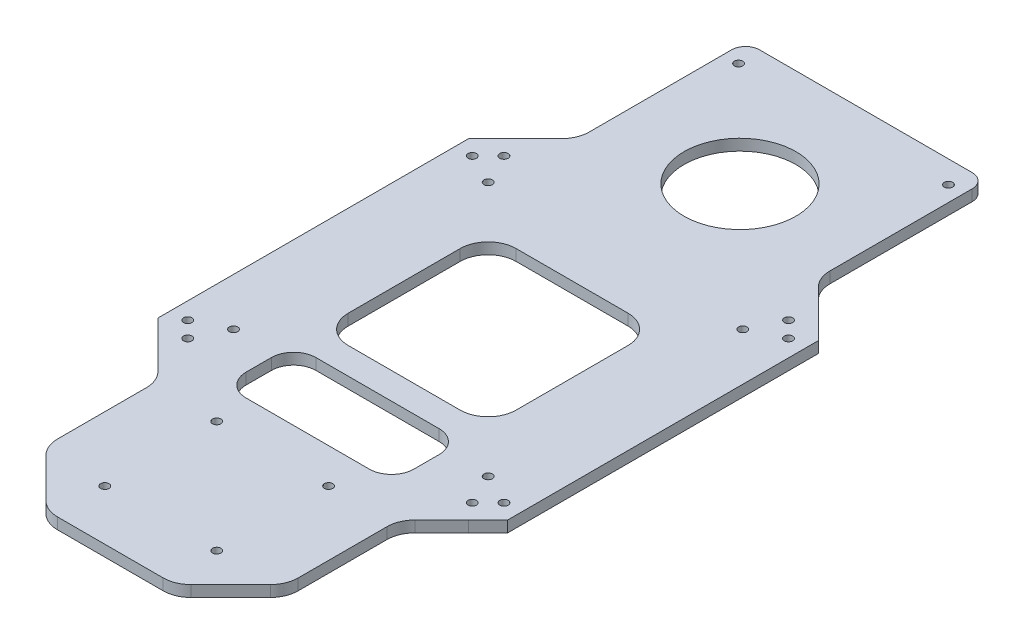
from build123d import *

# Parameters (mm, degrees)
SKETCH_1_R          = 1.5
EXTRUDE_1_DEPTH     = 4
CHAMFER_1_SIZE      = 7
SKETCH_3_W          = 60
SKETCH_3_H          = 60
SKETCH_3_R          = 1.5
SKETCH_3_R_2        = 20
SKETCH_3_H_2        = 10
SKETCH_3_H_3        = 5
CUT_EXTRUDE_1_DEPTH = 4
FILLET_3_R          = 10
FILLET_4_R          = 5
FILLET_5_R          = 8
CHAMFER_2_SIZE      = 12.5
FILLET_6_R          = 10
CHAMFER_3_SIZE      = 20
FILLET_7_R          = 10


with BuildPart() as part:
    # 草图1 → 凸台-拉伸1 (new body)
    with BuildSketch(Plane(origin=(0, 0, 0), x_dir=(1, 0, 0), z_dir=(0, 1, 0))):
        Polygon((-62.5, 62.5), (-62.5, -62.5), (-43, -62.5), (-43, -135), (43, -135), (43, -62.5), (62.5, -62.5), (62.5, 62.5), (43, 62.5), (43, 135), (-43, 135), (-43, 62.5), align=None)
        with Locations(Location((-56.5, -50.843145751, 0), (0, 0, 270))):
            Circle(SKETCH_1_R, mode=Mode.SUBTRACT)
        with Locations(Location((-50.843145751, -56.5, 0), (0, 0, 270))):
            Circle(SKETCH_1_R, mode=Mode.SUBTRACT)
        with Locations(Location((50.843145751, -56.5, 0), (0, 0, 270))):
            Circle(SKETCH_1_R, mode=Mode.SUBTRACT)
        with Locations(Location((56.5, -50.843145751, 0), (0, 0, 270))):
            Circle(SKETCH_1_R, mode=Mode.SUBTRACT)
        with Locations(Location((-56.5, 50.843145751, 0), (0, 0, 270))):
            Circle(SKETCH_1_R, mode=Mode.SUBTRACT)
        with Locations(Location((-50.843145751, 56.5, 0), (0, 0, 270))):
            Circle(SKETCH_1_R, mode=Mode.SUBTRACT)
        with Locations(Location((50.843145751, 56.5, 0), (0, 0, 270))):
            Circle(SKETCH_1_R, mode=Mode.SUBTRACT)
        with Locations(Location((56.5, 50.843145751, 0), (0, 0, 270))):
            Circle(SKETCH_1_R, mode=Mode.SUBTRACT)
        with Locations(Location((37.5, 127, 0), (0, 0, 270))):
            Circle(SKETCH_1_R, mode=Mode.SUBTRACT)
        with Locations(Location((-37.5, 127, 0), (0, 0, 270))):
            Circle(SKETCH_1_R, mode=Mode.SUBTRACT)
    extrude(amount=EXTRUDE_1_DEPTH)

    # 倒角1
    chamfer_1_edges = [part.edges().sort_by_distance(p)[0] for p in [
        (-62.5, 2, 62.5),
        (-62.5, 2, -62.5),
        (62.5, 2, -62.5),
        (62.5, 2, 62.5),
    ]]
    chamfer(chamfer_1_edges, length=CHAMFER_1_SIZE)

    # 草图3 → 切除-拉伸1 (cut)
    with BuildSketch(Plane(origin=(0, 4, 0), x_dir=(1, 0, 0), z_dir=(0, 1, 0))):
        Rectangle(SKETCH_3_W, SKETCH_3_H)
        with Locations(Location((-45.5, 45.5, 0), (0, 0, 270))):
            Circle(SKETCH_3_R)
        with Locations(Location((45.5, 45.5, 0), (0, 0, 270))):
            Circle(SKETCH_3_R)
        with Locations(Location((45.5, -45.5, 0), (0, 0, 270))):
            Circle(SKETCH_3_R)
        with Locations(Location((-45.5, -45.5, 0), (0, 0, 270))):
            Circle(SKETCH_3_R)
        with Locations(Location((0, 90, 0), (0, 0, 270))):
            Circle(SKETCH_3_R_2)
        with Locations((0, -44.5)):
            Rectangle(SKETCH_3_W, SKETCH_3_H_2)
        with Locations((0, -54.5)):
            Rectangle(SKETCH_3_W, SKETCH_3_H_2)
        with Locations((0, -62)):
            Rectangle(SKETCH_3_W, SKETCH_3_H_3)
        with Locations(Location((-20, -77, 0), (0, 0, 270))):
            Circle(SKETCH_3_R)
        with Locations(Location((20, -77, 0), (0, 0, 270))):
            Circle(SKETCH_3_R)
        with Locations(Location((20, -117, 0), (0, 0, 270))):
            Circle(SKETCH_3_R)
        with Locations(Location((-20, -117, 0), (0, 0, 270))):
            Circle(SKETCH_3_R)
    extrude(amount=-CUT_EXTRUDE_1_DEPTH, mode=Mode.SUBTRACT)

    # 圆角3
    fillet_3_edges = [part.edges().sort_by_distance(p)[0] for p in [
        (30, 2, 30),
        (-30, 2, 30),
        (-30, 2, -30),
        (30, 2, -30),
    ]]
    fillet(fillet_3_edges, radius=FILLET_3_R)

    # 圆角4
    fillet_4_edges = [part.edges().sort_by_distance(p)[0] for p in [
        (-43, 2, -135),
        (43, 2, -135),
    ]]
    fillet(fillet_4_edges, radius=FILLET_4_R)

    # 圆角5
    fillet_5_edges = [part.edges().sort_by_distance(p)[0] for p in [
        (30, 2, 39.5),
        (30, 2, 64.5),
        (-30, 2, 64.5),
        (-30, 2, 39.5),
    ]]
    fillet(fillet_5_edges, radius=FILLET_5_R)

    # 倒角2
    chamfer_2_edges = [part.edges().sort_by_distance(p)[0] for p in [
        (43, 2, -62.5),
        (-43, 2, -62.5),
        (43, 2, 62.5),
        (-43, 2, 62.5),
    ]]
    chamfer(chamfer_2_edges, length=CHAMFER_2_SIZE - 0.0001)  # a hair under: the kernel refuses the full size

    # 圆角6
    fillet_6_edges = [part.edges().sort_by_distance(p)[0] for p in [
        (43, 2, -74.9999),
        (-43, 2, -74.9999),
        (43, 2, 74.9999),
        (-43, 2, 74.9999),
    ]]
    fillet(fillet_6_edges, radius=FILLET_6_R)

    # 倒角3
    chamfer_3_edges = [part.edges().sort_by_distance(p)[0] for p in [
        (43, 2, 135),
        (-43, 2, 135),
    ]]
    chamfer(chamfer_3_edges, length=CHAMFER_3_SIZE)

    # 圆角7
    fillet_7_edges = [part.edges().sort_by_distance(p)[0] for p in [
        (43, 2, 115),
        (-23, 2, 135),
        (23, 2, 135),
        (-43, 2, 115),
    ]]
    fillet(fillet_7_edges, radius=FILLET_7_R)


solid = part.part
